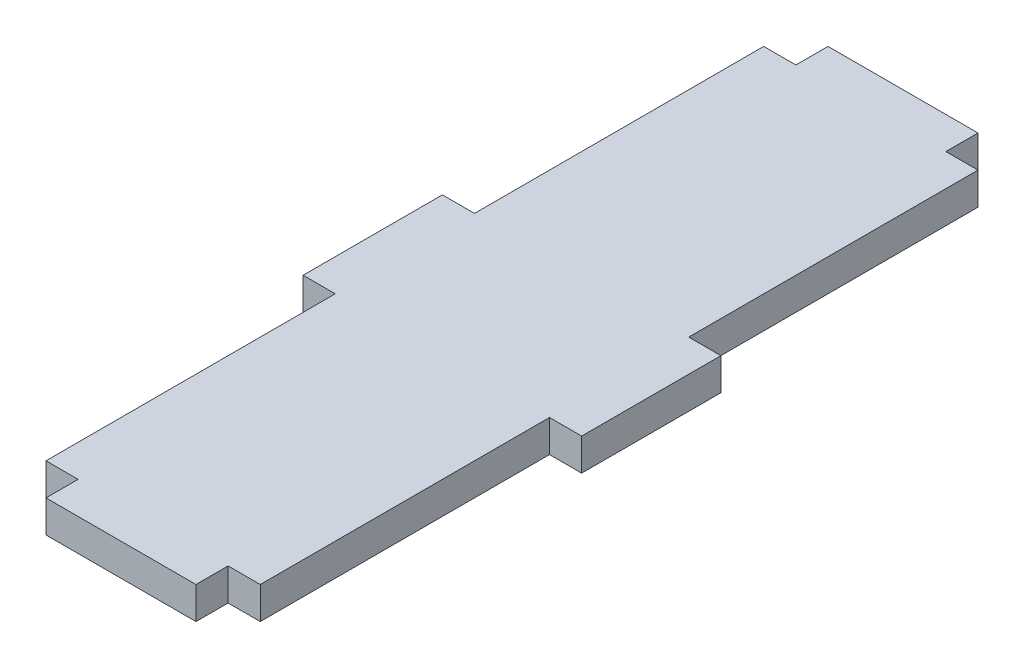
from build123d import *

# Parameters (mm, degrees)
SALIENTE_EXTRUIR1_DEPTH = 3


with BuildPart() as part:
    # Croquis2 → Saliente-Extruir1 (new body)
    with BuildSketch(Plane(origin=(0, 0, 0), x_dir=(1, 0, 0), z_dir=(0, 1, 0))):
        Polygon((-1.5, 22), (-4.5, 22), (-4.5, 9), (-1.5, 9), (-1.5, -18), (1.5, -18), (1.5, -21), (15.5, -21), (15.5, -18), (18.5, -18), (18.5, 9), (21.5, 9), (21.5, 22), (18.5, 22), (18.5, 49), (15.5, 49), (15.5, 52), (1.5, 52), (1.5, 49), (-1.5, 49), align=None)
    extrude(amount=SALIENTE_EXTRUIR1_DEPTH)


solid = part.part
